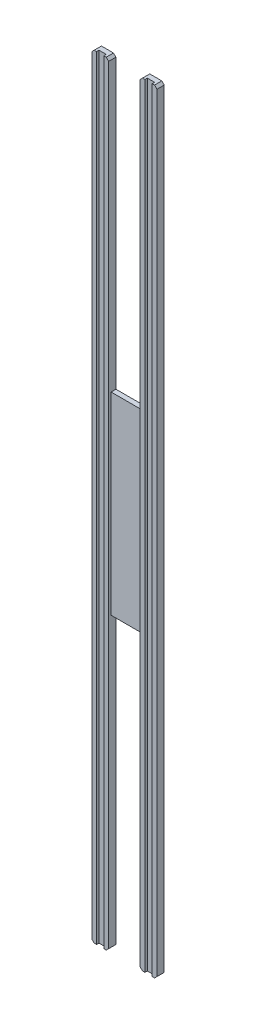
from build123d import *

# Parameters (mm, degrees)
SCHIZZO1_W                   = 6.5
SCHIZZO1_H                   = 80
ESTRUSIONE_ESTRUSIONE1_DEPTH = 2
SCHIZZO2_W                   = 3
SCHIZZO2_H                   = 320
ESTRUSIONE_ESTRUSIONE2_DEPTH = 7
SMUSSO1_SIZE                 = 1
SCHIZZO4_W                   = 3
SCHIZZO4_H                   = 1
TAGLIO_ESTRUSIONE1_DEPTH     = 321.298688727
SMUSSO1_OF_SPECCHIA9_SIZE    = 1


with BuildPart() as part:
    # Schizzo1 → Estrusione-Estrusione1 (new body)
    with BuildSketch(Plane.XY):
        with Locations((3.25, 40)):
            Rectangle(SCHIZZO1_W, SCHIZZO1_H)
    estrusione_estrusione1 = extrude(amount=ESTRUSIONE_ESTRUSIONE1_DEPTH)

    # Schizzo2 → Estrusione-Estrusione2 (add)
    with BuildSketch(Plane(origin=(6.5, 0, 0), x_dir=(0, 0, -1), z_dir=(1, 0, 0))):
        with Locations((-1.5, 40)):
            Rectangle(SCHIZZO2_W, SCHIZZO2_H)
    estrusione_estrusione2 = extrude(amount=ESTRUSIONE_ESTRUSIONE2_DEPTH)

    # Smusso1
    smusso1_edges = [part.edges().sort_by_distance(p)[0] for p in [
        (6.5, -120, 1.5),
        (13.5, -120, 1.5),
        (6.5, 200, 1.5),
        (13.5, 200, 1.5),
    ]]
    chamfer(smusso1_edges, length=SMUSSO1_SIZE)

    # Schizzo4 → Taglio-Estrusione1 (cut, through all)
    with BuildSketch(Plane.XZ.offset(120)):
        with Locations((10, 2.5)):
            Rectangle(SCHIZZO4_W, SCHIZZO4_H)
    taglio_estrusione1 = extrude(amount=-TAGLIO_ESTRUSIONE1_DEPTH, mode=Mode.SUBTRACT)

    # Specchia9: Estrusione-Estrusione1, Estrusione-Estrusione2, Taglio-Estrusione1 across plane
    add(estrusione_estrusione1.mirror(Plane.ZY))
    add(estrusione_estrusione2.mirror(Plane.ZY))
    add(taglio_estrusione1.mirror(Plane.ZY), mode=Mode.SUBTRACT)

    # Smusso1 of Specchia9
    smusso1_of_specchia9_edges = [part.edges().sort_by_distance(p)[0] for p in [
        (-6.5, -120, 1.5),
        (-13.5, -120, 1.5),
        (-6.5, 200, 1.5),
        (-13.5, 200, 1.5),
    ]]
    chamfer(smusso1_of_specchia9_edges, length=SMUSSO1_OF_SPECCHIA9_SIZE)


solid = part.part
